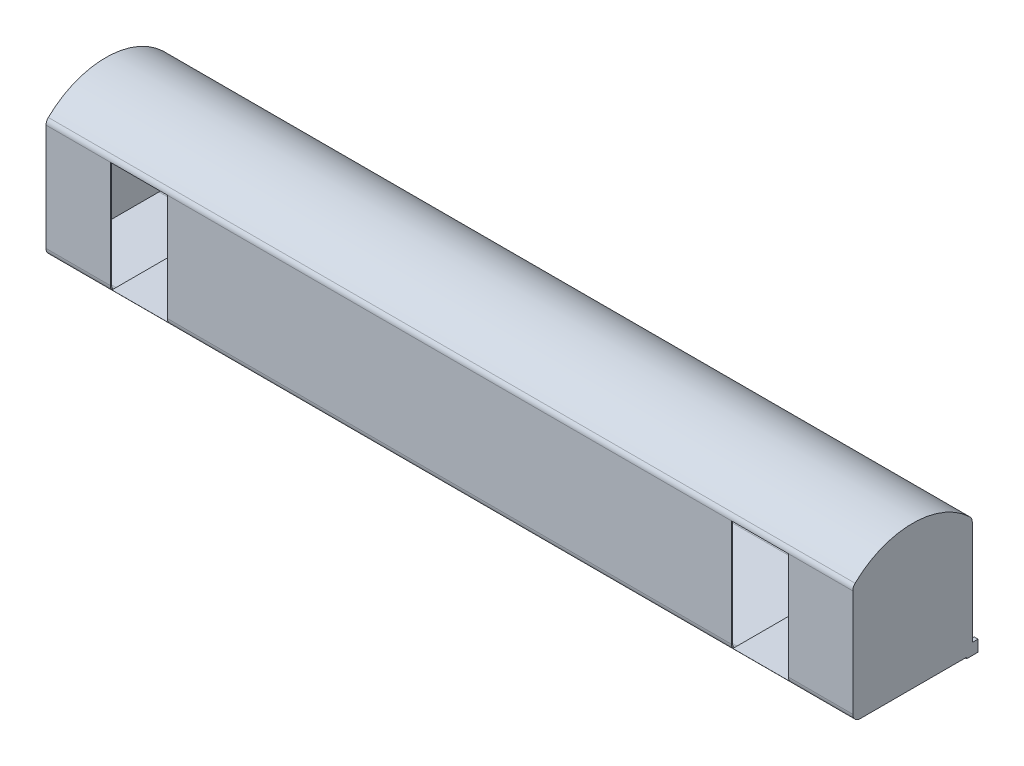
from build123d import *

# Parameters (mm, degrees)
BOSS_EXTRUDE1_DEPTH = 21279
CUT_EXTRUDE1_REACH  = 21627.741
SKETCH2_W           = 1500
SKETCH2_H           = 2934.877558964
SHELL1_START        = 3200
SHELL1_DEPTH        = 14879
SHELL1_START_2      = 30
SHELL1_2_DEPTH      = 1670
SHELL1_START_3      = 19579
SHELL1_3_DEPTH      = 1670
SHELL1_START_4      = 1700
SHELL1_4_DEPTH      = 17879
SKETCH3_W           = 1400
SKETCH3_H           = 400
BOSS_EXTRUDE2_DEPTH = 150
SWEEP1_PROFILE_R    = 50
LPATTERN1_COUNT     = 2
LPATTERN1_PITCH     = 1500
SKETCH23_W          = 300
SKETCH23_H          = 300
BOSS_EXTRUDE3_DEPTH = 100
LPATTERN2_COUNT     = 2
LPATTERN2_PITCH     = 3330
SKETCH24_R          = 35
BOSS_EXTRUDE4_DEPTH = 3230


# Read off the part's stored shape, not the designer's step: Shell1
with BuildPart() as part:
    # Sketch1 → Boss-Extrude1 (new body)
    with BuildSketch(Plane(origin=(0, 0, 0), x_dir=(0, 0, -1), z_dir=(1, 0, 0))):
        with BuildLine():
            Line((-1376, -1550), (1376, -1550))
            ThreePointArc((1376, -1550), (1517.421356237, -1491.421356237), (1576, -1350))
            Line((1576, -1350), (1576, 1467.438779482))
            ThreePointArc((1576, 1467.438779482), (1560.082466512, 1545.62858395), (1514.863544773, 1611.372500108))
            ThreePointArc((1514.863544773, 1611.372500108), (0, 2223), (-1514.863544773, 1611.372500108))
            ThreePointArc((-1514.863544773, 1611.372500108), (-1560.082466512, 1545.62858395), (-1576, 1467.438779482))
            Line((-1576, 1467.438779482), (-1576, -1350))
            ThreePointArc((-1576, -1350), (-1517.421356237, -1491.421356237), (-1376, -1550))
        make_face()
    extrude(amount=BOSS_EXTRUDE1_DEPTH)

    # Cut-Extrude1: up to this face of the body (flat: up to its plane)
    cut_extrude1_end = Plane(part.part.faces().sort_by_distance((10639.5, 58.719389741, 1576))[0])
    # Sketch2 → Cut-Extrude1 (cut, up to the picked face)
    with BuildSketch(Plane(origin=(0, 0, -1576), x_dir=(-1, 0, 0), z_dir=(0, 0, -1)), mode=Mode.PRIVATE) as cut_extrude1_sk1:
        with Locations((-18829, 0)):
            Rectangle(SKETCH2_W, SKETCH2_H)
    cut_extrude1_tool1 = split(extrude(cut_extrude1_sk1.sketch, amount=-CUT_EXTRUDE1_REACH, mode=Mode.PRIVATE), bisect_by=cut_extrude1_end, keep=Keep.BOTH, mode=Mode.PRIVATE)
    # Sketch2 → Cut-Extrude1 (cut, up to the picked face)
    with BuildSketch(Plane(origin=(0, 0, -1576), x_dir=(-1, 0, 0), z_dir=(0, 0, -1)), mode=Mode.PRIVATE) as cut_extrude1_sk2:
        with Locations((-2450, 0)):
            Rectangle(SKETCH2_W, SKETCH2_H)
    cut_extrude1_tool2 = split(extrude(cut_extrude1_sk2.sketch, amount=-CUT_EXTRUDE1_REACH, mode=Mode.PRIVATE), bisect_by=cut_extrude1_end, keep=Keep.BOTH, mode=Mode.PRIVATE)
    add(cut_extrude1_tool1.solids().sort_by(Axis((18829, 0, -1576), (0, 0, 1)))[0], mode=Mode.SUBTRACT)
    add(cut_extrude1_tool2.solids().sort_by(Axis((2450, 0, -1576), (0, 0, 1)))[0], mode=Mode.SUBTRACT)

    # Shell1 outline → Shell1 (cut)
    with BuildSketch(Plane.YZ.offset(SHELL1_START)):
        with BuildLine():
            Line((1467.438779482, 1546), (-1350, 1546))
            ThreePointArc((-1350, 1546), (-1470.208152802, 1496.208152802), (-1520, 1376))
            Line((-1520, 1376), (-1520, -1376))
            ThreePointArc((-1520, -1376), (-1470.208152802, -1496.208152802), (-1350, -1546))
            Line((-1350, -1546), (1467.438779482, -1546))
            ThreePointArc((1467.438779482, -1546), (1533.90011328, -1532.470096536), (1589.782442014, -1494.034013057))
            ThreePointArc((1589.782442014, -1494.034013057), (2193, 0), (1589.782442014, 1494.034013057))
            ThreePointArc((1589.782442014, 1494.034013057), (1533.90011328, 1532.470096536), (1467.438779482, 1546))
        make_face()
    extrude(amount=SHELL1_DEPTH, mode=Mode.SUBTRACT)

    # Shell1 2 outline → Shell1 2 (cut)
    with BuildSketch(Plane.YZ.offset(SHELL1_START_2)):
        with BuildLine():
            Line((1467.438779482, 1546), (-1350, 1546))
            ThreePointArc((-1350, 1546), (-1470.208152802, 1496.208152802), (-1520, 1376))
            Line((-1520, 1376), (-1520, -1376))
            ThreePointArc((-1520, -1376), (-1470.208152802, -1496.208152802), (-1350, -1546))
            Line((-1350, -1546), (1467.438779482, -1546))
            ThreePointArc((1467.438779482, -1546), (1533.90011328, -1532.470096536), (1589.782442014, -1494.034013057))
            ThreePointArc((1589.782442014, -1494.034013057), (2193, 0), (1589.782442014, 1494.034013057))
            ThreePointArc((1589.782442014, 1494.034013057), (1533.90011328, 1532.470096536), (1467.438779482, 1546))
        make_face()
    extrude(amount=SHELL1_2_DEPTH, mode=Mode.SUBTRACT)

    # Shell1 3 outline → Shell1 3 (cut)
    with BuildSketch(Plane.YZ.offset(SHELL1_START_3)):
        with BuildLine():
            Line((1467.438779482, 1546), (-1350, 1546))
            ThreePointArc((-1350, 1546), (-1470.208152802, 1496.208152802), (-1520, 1376))
            Line((-1520, 1376), (-1520, -1376))
            ThreePointArc((-1520, -1376), (-1470.208152802, -1496.208152802), (-1350, -1546))
            Line((-1350, -1546), (1467.438779482, -1546))
            ThreePointArc((1467.438779482, -1546), (1533.90011328, -1532.470096536), (1589.782442014, -1494.034013057))
            ThreePointArc((1589.782442014, -1494.034013057), (2193, 0), (1589.782442014, 1494.034013057))
            ThreePointArc((1589.782442014, 1494.034013057), (1533.90011328, 1532.470096536), (1467.438779482, 1546))
        make_face()
    extrude(amount=SHELL1_3_DEPTH, mode=Mode.SUBTRACT)

    # Shell1 4 outline → Shell1 4 (cut)
    with BuildSketch(Plane.YZ.offset(SHELL1_START_4)):
        with BuildLine():
            ThreePointArc((1589.782442014, 1494.034013057), (1547.499511982, 1525.967593539), (1497.438779482, 1543.332005307))
            Line((1497.438779482, 1543.332005307), (1497.438779482, -1543.332005307))
            ThreePointArc((1497.438779482, -1543.332005307), (1547.499511982, -1525.967593539), (1589.782442014, -1494.034013057))
            ThreePointArc((1589.782442014, -1494.034013057), (2193, 0), (1589.782442014, 1494.034013057))
        make_face()
        with BuildLine():
            Line((-1497.438779482, -1460.627455975), (-1497.438779482, 1460.627455975))
            ThreePointArc((-1497.438779482, 1460.627455975), (-1514.262887641, 1419.791594445), (-1520, 1376))
            Line((-1520, 1376), (-1520, -1376))
            ThreePointArc((-1520, -1376), (-1514.262887641, -1419.791594445), (-1497.438779482, -1460.627455975))
        make_face()
    extrude(amount=SHELL1_4_DEPTH, mode=Mode.SUBTRACT)

    # Sketch3 → Boss-Extrude2 (add, symmetric)
    with BuildSketch(Plane(origin=(0, 0, -1576), x_dir=(-1, 0, 0), z_dir=(0, 0, -1))):
        Polygon((-19579, -2967.438779482), (-19529, -2967.438779482), (-19529, -2867.438779482), (-18129, -2867.438779482), (-18129, -2967.438779482), (-18079, -2967.438779482), (-18079, -1467.438779482), (-18129, -1467.438779482), (-18129, -1917.438779482), (-19529, -1917.438779482), (-19529, -1467.438779482), (-19579, -1467.438779482), align=None)
        with Locations((-18829, -2167.438779482)):
            Rectangle(SKETCH3_W, SKETCH3_H, mode=Mode.SUBTRACT)
        with Locations((-18829, -2617.438779482)):
            Rectangle(SKETCH3_W, SKETCH3_H, mode=Mode.SUBTRACT)
    extrude(amount=BOSS_EXTRUDE2_DEPTH, both=True)

    # Sweep1: sweep along a path in Sketch4
    with BuildLine(Plane.ZY.offset(-19579)) as sweep1_path:
        Line((-1490.298311455, -1377.177994717), (-1494.224798498, -1377.177994717))
        ThreePointArc((-1494.224798498, -1377.177994717), (-1635.646154735, -1318.599350954), (-1694.224798498, -1177.177994717))
        Line((-1694.224798498, -1177.177994717), (-1694.224798498, 1186.02590472))
        ThreePointArc((-1694.224798498, 1186.02590472), (-1635.646154735, 1327.447260957), (-1494.224798498, 1386.02590472))
        Line((-1494.224798498, 1386.02590472), (-1490.298311455, 1386.02590472))
    # Sweep1 profile (on start of the path) → Sweep1 (sweep)
    with BuildSketch(Plane(origin=(19579, -1377.177994717, -1490.298311455), x_dir=(-1, 0, 0), z_dir=(0, 0, -1))):
        Circle(SWEEP1_PROFILE_R)
    sweep1 = sweep(path=sweep1_path.line)

    # LPattern1: Sweep1 ×2
    with Locations(*[(-i * LPATTERN1_PITCH, 0, 0) for i in range(1, LPATTERN1_COUNT)]):
        add(sweep1)

    # Sketch23 → Boss-Extrude3 (add)
    with BuildSketch(Plane(origin=(21279, 0, 0), x_dir=(0, 0, -1), z_dir=(1, 0, 0))):
        with Locations((1577.214050007, -1435.807071765)):
            Rectangle(SKETCH23_W, SKETCH23_H)
    boss_extrude3 = extrude(amount=-BOSS_EXTRUDE3_DEPTH)

    # LPattern2: Boss-Extrude3 ×2
    with Locations(*[(-i * LPATTERN2_PITCH, 0, 0) for i in range(1, LPATTERN2_COUNT)]):
        add(boss_extrude3)

    # Sketch24 → Boss-Extrude4 (add)
    with BuildSketch(Plane(origin=(21179, 19.083157854, -13.694711278), x_dir=(0, 0, 1), z_dir=(-1, 0, 0))):
        with Locations((-1636.925881354, -1440.790208196)):
            Circle(SKETCH24_R)
    extrude(amount=BOSS_EXTRUDE4_DEPTH)


solid = part.part
